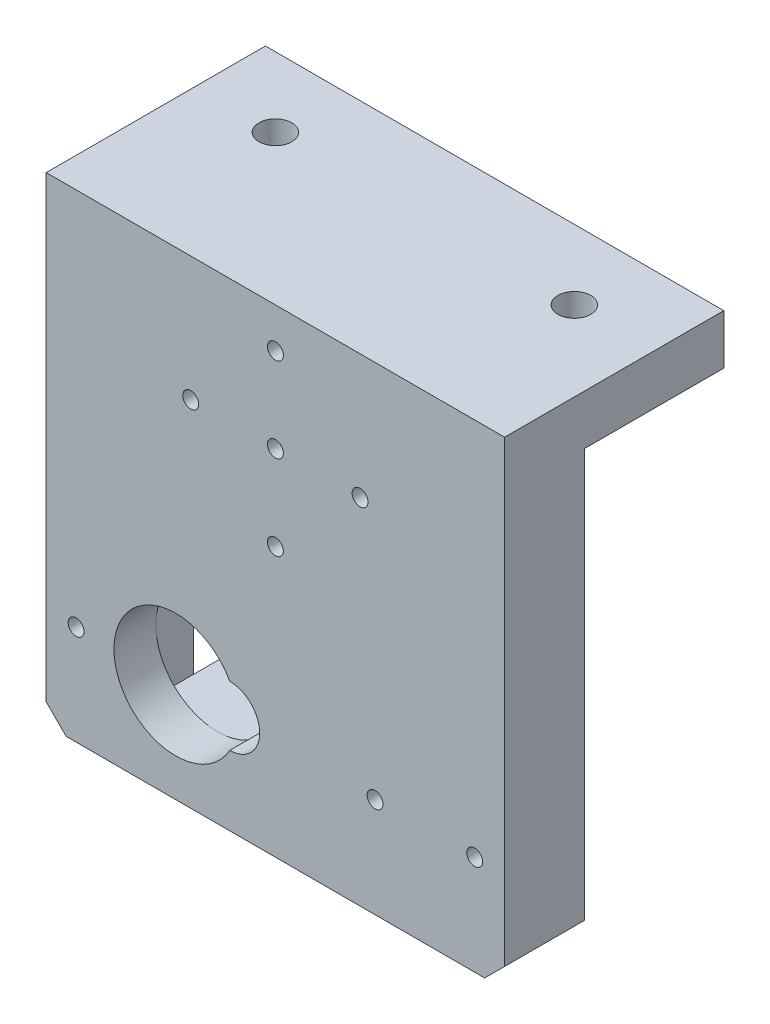
from build123d import *

# Parameters (mm, degrees)
SKETCH_1_W                  = 46
SKETCH_1_H                  = 48
EXTRUDE_1_DEPTH             = 8
CHAMFER_1_SIZE              = 2
SKETCH_2_W                  = 46
SKETCH_2_H                  = 5
EXTRUDE_2_DEPTH             = 14
HOLE_WIZARD_M4_1_D          = 3.3
HOLE_WIZARD_M4_1_DEPTH      = 11.5
HOLE_WIZARD_M4_1_TIP        = 0.991420021
HOLE_WIZARD_M2_1_AT_2_COUNT = 2
HOLE_WIZARD_M2_1_AT_2_PITCH = 10
SKETCH_8_R                  = 0.8
CUT_EXTRUDE_1_DEPTH         = 23
SKETCH_9_W                  = 24
SKETCH_9_H                  = 12.4
CUT_EXTRUDE_2_DEPTH         = 3.8
SKETCH_11_W                 = 24
SKETCH_11_H                 = 3.8
SKETCH_11_H_2               = 4
EXTRUDE_3_DEPTH             = 15
FILLET_1_R                  = 3
HOLE_WIZARD_M2_2_D          = 1.6
HOLE_WIZARD_M2_2_DEPTH      = 5.2
HOLE_WIZARD_M2_2_TIP        = 0.480688495
HOLE_WIZARD_M2_3_D          = 1.6
HOLE_WIZARD_M2_3_DEPTH      = 5.2
HOLE_WIZARD_M2_3_TIP        = 0.480688495


with BuildPart() as part:
    # 草图1 → 凸台-拉伸1 (new body)
    with BuildSketch(Plane.XY):
        Rectangle(SKETCH_1_W, SKETCH_1_H)
    extrude(amount=EXTRUDE_1_DEPTH)

    # 倒角1
    chamfer_1_edges = [part.edges().sort_by_distance(p)[0] for p in [
        (23, -24, 4),
        (-23, -24, 4),
    ]]
    chamfer(chamfer_1_edges, length=CHAMFER_1_SIZE)

    # 草图2 → 凸台-拉伸2 (add)
    with BuildSketch(Plane(origin=(0, 0, 0), x_dir=(-1, 0, 0), z_dir=(0, 0, -1))):
        with Locations((0, 21.5)):
            Rectangle(SKETCH_2_W, SKETCH_2_H)
    extrude(amount=EXTRUDE_2_DEPTH)

    # M4 螺纹孔1
    with Locations(Plane(origin=(0, 24, 0), x_dir=(1, 0, 0), z_dir=(0, 1, 0))):
        with Locations((15, 7), (-15, 7)):
            Hole(HOLE_WIZARD_M4_1_D / 2, depth=HOLE_WIZARD_M4_1_DEPTH)
            with Locations((0, 0, -(HOLE_WIZARD_M4_1_DEPTH + HOLE_WIZARD_M4_1_TIP / 2))):  # 118° drill point
                Cone(0, HOLE_WIZARD_M4_1_D / 2, HOLE_WIZARD_M4_1_TIP, mode=Mode.SUBTRACT)

    # 草图6 → M2 螺纹孔1 (revolve, cut)
    with BuildSketch(Plane(origin=(10, -14, 8), x_dir=(0, -1, 0), z_dir=(1, 0, 0))):
        Polygon((0, 0), (0, 46.480688495), (0.8, 46), (0.8, 0), align=None)
    hole_wizard_m2_1 = revolve(axis=Axis((10, -14, 14.35), (0, 0, -1)), mode=Mode.SUBTRACT)

    # M2 螺纹孔1 at 2: M2 螺纹孔1 ×2
    with Locations(*[(i * HOLE_WIZARD_M2_1_AT_2_PITCH, 0, 0) for i in range(1, HOLE_WIZARD_M2_1_AT_2_COUNT)]):
        add(hole_wizard_m2_1, mode=Mode.SUBTRACT)

    # 镜向1: M2 螺纹孔1 across plane
    add(hole_wizard_m2_1.mirror(Plane(origin=(0, 0, 0), x_dir=(0, 0, 1), z_dir=(1, 0, 0))), mode=Mode.SUBTRACT)

    # 镜向1 copy 1 sketch → 镜向1 copy 1 (revolve, cut)
    with BuildSketch(Plane(origin=(-20, -14, 8), x_dir=(0, -1, 0), z_dir=(-1, 0, 0))):
        Polygon((0, 0), (0, -46.480688495), (0.8, -46), (0.8, 0), align=None)
    revolve(axis=Axis((-20, -14, 14.35), (0, 0, 1)), mode=Mode.SUBTRACT)

    # 草图8 → 切除-拉伸1 (cut)
    # profile 1 of 3: a face of its own
    with BuildSketch(Plane.XY.offset(8)):
        with BuildLine():
            ThreePointArc((-4.574136013, -11), (-16.2, -14), (-4.574136013, -17))
            Line((-4.574136013, -17), (-4.574136013, -11))
        make_face()
        with Locations((-10, -14)):
            Circle(SKETCH_8_R, mode=Mode.SUBTRACT)
    # profile 2 of 3: a face of its own
    with BuildSketch(Plane.XY.offset(8)):
        with BuildLine():
            Line((-4.574136013, -11), (-4.574136013, -17))
            ThreePointArc((-4.574136013, -17), (-3.996652737, -15.549135773), (-3.8, -14))
            ThreePointArc((-3.8, -14), (-3.996652737, -12.450864227), (-4.574136013, -11))
        make_face()
    # profile 3 of 3: a face of its own
    with BuildSketch(Plane.XY.offset(8)):
        with BuildLine():
            ThreePointArc((-3.8, -14), (-3.996652737, -15.549135773), (-4.574136013, -17))
            Line((-4.574136013, -17), (-1.574136013, -17))
            Line((-1.574136013, -17), (-1.574136013, -11))
            Line((-1.574136013, -11), (-4.574136013, -11))
            ThreePointArc((-4.574136013, -11), (-3.996652737, -12.450864227), (-3.8, -14))
        make_face()
    extrude(amount=-CUT_EXTRUDE_1_DEPTH, mode=Mode.SUBTRACT)

    # 草图9 → 切除-拉伸2 (cut)
    with BuildSketch(Plane(origin=(0, 0, 0), x_dir=(-1, 0, 0), z_dir=(0, 0, -1))):
        with Locations((4.2, -14)):
            Rectangle(SKETCH_9_W, SKETCH_9_H)
    extrude(amount=-CUT_EXTRUDE_2_DEPTH, mode=Mode.SUBTRACT)

    # 草图11 → 凸台-拉伸3 (add)
    with BuildSketch(Plane(origin=(0, 0, 0), x_dir=(-1, 0, 0), z_dir=(0, 0, -1))):
        with Locations((4.2, -22.1)):
            Rectangle(SKETCH_11_W, SKETCH_11_H)
        with Locations((4.2, -5.8)):
            Rectangle(SKETCH_11_W, SKETCH_11_H_2)
    extrude(amount=EXTRUDE_3_DEPTH)

    # 圆角1
    fillet_1_edges = [part.edges().sort_by_distance(p)[0] for p in [
        (-1.574136013, -11, 5.9),
        (-1.574136013, -17, 5.9),
    ]]
    fillet(fillet_1_edges, radius=FILLET_1_R - 0.0001)  # a hair under: the kernel refuses the full size

    # M2 螺纹孔2
    with Locations(Plane.XY.offset(8)):
        with Locations((0, 11.5)):
            Hole(HOLE_WIZARD_M2_2_D / 2, depth=HOLE_WIZARD_M2_2_DEPTH)
            with Locations((0, 0, -(HOLE_WIZARD_M2_2_DEPTH + HOLE_WIZARD_M2_2_TIP / 2))):  # 118° drill point
                Cone(0, HOLE_WIZARD_M2_2_D / 2, HOLE_WIZARD_M2_2_TIP, mode=Mode.SUBTRACT)

    # M2 螺纹孔3
    with Locations(Plane(origin=(0, 20, 8), x_dir=(1, 0, 0), z_dir=(0, 0, 1))):
        with Locations((0, 0), (8.5, -8.5), (0, -17), (-8.5, -8.5)):
            Hole(HOLE_WIZARD_M2_3_D / 2, depth=HOLE_WIZARD_M2_3_DEPTH)
            with Locations((0, 0, -(HOLE_WIZARD_M2_3_DEPTH + HOLE_WIZARD_M2_3_TIP / 2))):  # 118° drill point
                Cone(0, HOLE_WIZARD_M2_3_D / 2, HOLE_WIZARD_M2_3_TIP, mode=Mode.SUBTRACT)


solid = part.part
